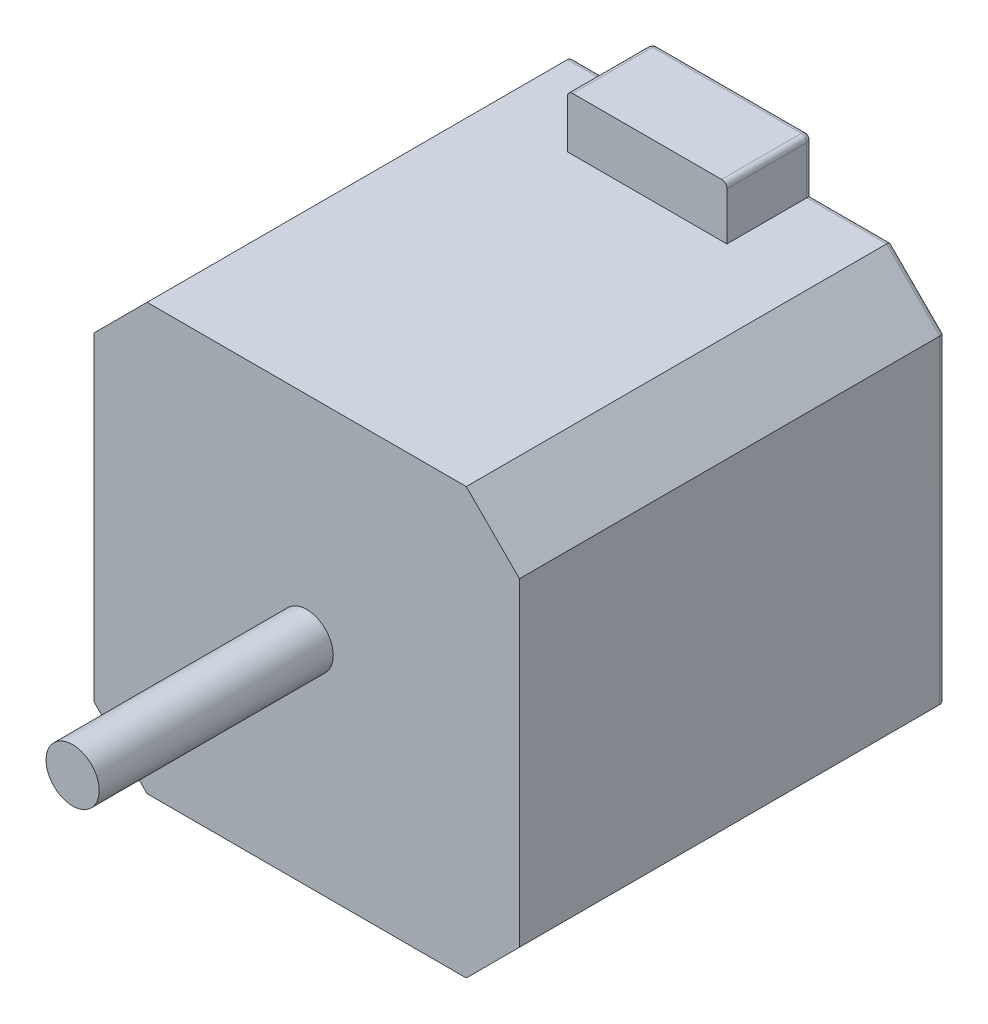
from build123d import *

# Parameters (mm, degrees)
SKETCH1_W           = 40
SKETCH1_H           = 40
BOSS_EXTRUDE1_DEPTH = 40
CHAMFER1_SIZE       = 5
SKETCH2_W           = 15
SKETCH2_H           = 5
BOSS_EXTRUDE2_DEPTH = 8
FILLET1_R           = 0.5
FILLET2_R           = 0.5
SKETCH3_R           = 2.5
BOSS_EXTRUDE3_DEPTH = 62


with BuildPart() as part:
    # Sketch1 → Boss-Extrude1 (new body)
    with BuildSketch(Plane.XY):
        Rectangle(SKETCH1_W, SKETCH1_H)
    extrude(amount=BOSS_EXTRUDE1_DEPTH)

    # Chamfer1
    chamfer1_edges = [part.edges().sort_by_distance(p)[0] for p in [
        (-20, 20, 20),
        (20, 20, 20),
        (20, -20, 20),
        (-20, -20, 20),
    ]]
    chamfer(chamfer1_edges, length=CHAMFER1_SIZE)

    # Sketch2 → Boss-Extrude2 (add)
    with BuildSketch(Plane.XY):
        with Locations((0, 22.5)):
            Rectangle(SKETCH2_W, SKETCH2_H)
    extrude(amount=BOSS_EXTRUDE2_DEPTH)

    # Fillet1
    fillet1_edges = [part.edges().sort_by_distance(p)[0] for p in [
        (0, -20, 0),
        (-20, 0, 0),
        (11.25, 20, 0),
        (20, 0, 0),
        (17.5, 17.5, 0),
        (-17.5, 17.5, 0),
        (17.5, -17.5, 0),
        (-17.5, -17.5, 0),
        (-11.25, 20, 0),
        (-7.5, 22.5, 0),
        (7.5, 22.5, 0),
        (0, 25, 0),
    ]]
    fillet(fillet1_edges, radius=FILLET1_R)

    # Fillet2
    # the kernel refuses this fillet: 0.5 mm, written as the material it takes off along each edge
    with BuildSketch(Plane(origin=(-7, 24.5, 0.5), x_dir=(0, 1, 0), z_dir=(-1, 0, 0))) as fillet2_piece_1_section:
        Polygon((0, 0), (FILLET2_R, 0), (FILLET2_R, FILLET2_R), (0, FILLET2_R), align=None)
    fillet2_piece_1 = extrude(amount=FILLET2_R, mode=Mode.PRIVATE)
    fillet2_piece_1 = fillet2_piece_1 - Plane(origin=(-7, 24.5, 0.5), x_dir=(0, -0.7071067811865475, 0.7071067811865475), z_dir=(-1, 0, 0)) * Sphere(FILLET2_R, mode=Mode.PRIVATE)
    add(fillet2_piece_1, mode=Mode.SUBTRACT)
    with BuildSketch(Plane(origin=(7, 24.5, 0.5), x_dir=(0, 1, 0), z_dir=(1, 0, 0))) as fillet2_piece_2_section:
        Polygon((0, 0), (FILLET2_R, 0), (FILLET2_R, -FILLET2_R), (0, -FILLET2_R), align=None)
    fillet2_piece_2 = extrude(amount=FILLET2_R, mode=Mode.PRIVATE)
    fillet2_piece_2 = fillet2_piece_2 - Plane(origin=(7, 24.5, 0.5), x_dir=(0, -0.7071067811865475, 0.7071067811865475), z_dir=(1, 0, 0)) * Sphere(FILLET2_R, mode=Mode.PRIVATE)
    add(fillet2_piece_2, mode=Mode.SUBTRACT)
    with BuildSketch(Plane(origin=(-7.5, 25, 0.5), x_dir=(0, -1, 0), z_dir=(0, 0, 1))) as fillet2_piece_3:
        with BuildLine():
            CenterArc((FILLET2_R, FILLET2_R), FILLET2_R, 180, 90)
            Line((0, FILLET2_R), (0, 0))
            Line((0, 0), (FILLET2_R, 0))
        make_face()
    extrude(amount=8.75, mode=Mode.SUBTRACT)
    with BuildSketch(Plane(origin=(7.5, 25, 0.5), x_dir=(0, -1, 0), z_dir=(0, 0, 1))) as fillet2_piece_4:
        with BuildLine():
            CenterArc((FILLET2_R, -FILLET2_R), FILLET2_R, 90, 90)
            Line((0, -FILLET2_R), (0, 0))
            Line((0, 0), (FILLET2_R, 0))
        make_face()
    extrude(amount=8.75, mode=Mode.SUBTRACT)

    # Sketch3 → Boss-Extrude3 (add)
    with BuildSketch(Plane.XY):
        Circle(SKETCH3_R)
    extrude(amount=BOSS_EXTRUDE3_DEPTH)


solid = part.part
